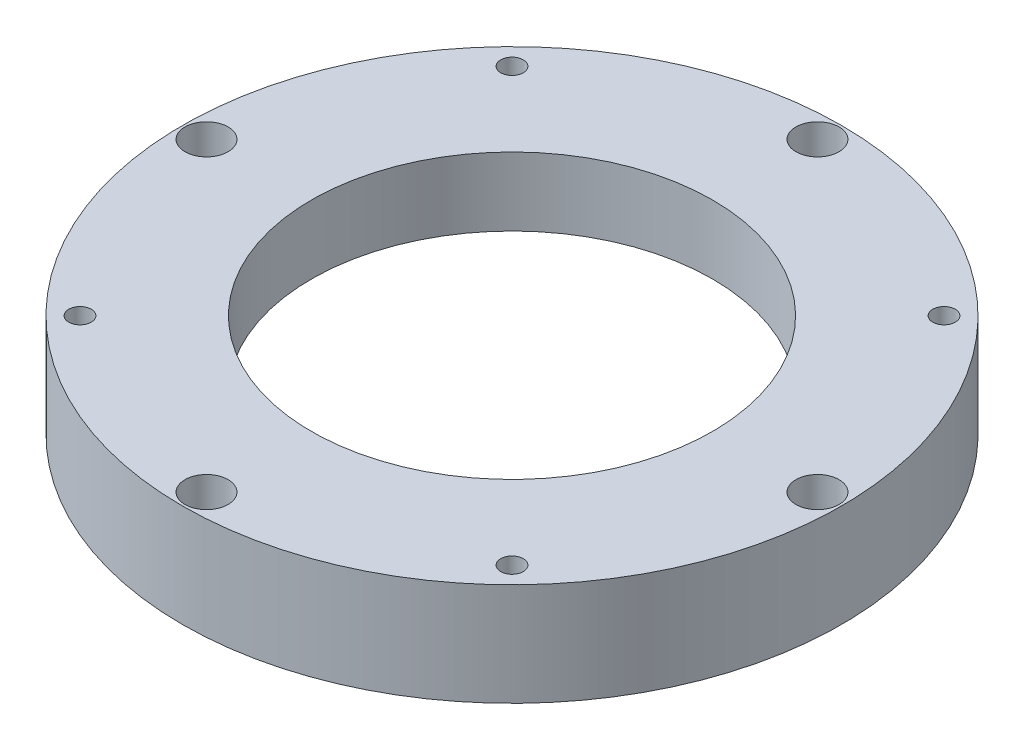
from build123d import *

# Parameters (mm, degrees)
SKETCH1_R           = 45.85
SKETCH1_R_2         = 1.5635
SKETCH1_R_3         = 40
BOSS_EXTRUDE1_DEPTH = 4.7625
BOSS_EXTRUDE2_START = 4.7625
SKETCH1_4_R         = 45.85
SKETCH1_4_R_2       = 1.5635
SKETCH1_4_R_3       = 27.9
BOSS_EXTRUDE2_DEPTH = 4.7625
CUT_EXTRUDE2_DEPTH  = 4.7625
BOSS_EXTRUDE3_START = 4.7625
SKETCH3_R           = 45.85
SKETCH3_R_2         = 3
SKETCH3_R_3         = 27.9
SKETCH3_R_4         = 1.565
BOSS_EXTRUDE3_DEPTH = 4.7625


with BuildPart() as part:
    # Sketch1 → Boss-Extrude1 (new body)
    with BuildSketch(Plane(origin=(0, 0, 0), x_dir=(1, 0, 0), z_dir=(0, 1, 0))):
        Circle(SKETCH1_R)
        with Locations((-30.0520382, -30.0520382)):
            Circle(SKETCH1_R_2, mode=Mode.SUBTRACT)
        with Locations((0, -42.5)):
            Circle(SKETCH1_R_2, mode=Mode.SUBTRACT)
        with Locations((30.0520382, -30.0520382)):
            Circle(SKETCH1_R_2, mode=Mode.SUBTRACT)
        with Locations((-42.5, 0)):
            Circle(SKETCH1_R_2, mode=Mode.SUBTRACT)
        with Locations((-30.0520382, 30.0520382)):
            Circle(SKETCH1_R_2, mode=Mode.SUBTRACT)
        Circle(SKETCH1_R_3, mode=Mode.SUBTRACT)
        with Locations((42.5, 0)):
            Circle(SKETCH1_R_2, mode=Mode.SUBTRACT)
        with Locations((0, 42.5)):
            Circle(SKETCH1_R_2, mode=Mode.SUBTRACT)
        with Locations((30.0520382, 30.0520382)):
            Circle(SKETCH1_R_2, mode=Mode.SUBTRACT)
    extrude(amount=-BOSS_EXTRUDE1_DEPTH)

    # Sketch1<4> → Boss-Extrude2 (add)
    with BuildSketch(Plane(origin=(0, 0, 0), x_dir=(1, 0, 0), z_dir=(0, 1, 0)).offset(BOSS_EXTRUDE2_START)):
        Circle(SKETCH1_4_R)
        with Locations((-30.0520382, -30.0520382)):
            Circle(SKETCH1_4_R_2, mode=Mode.SUBTRACT)
        with Locations((0, -42.5)):
            Circle(SKETCH1_4_R_2, mode=Mode.SUBTRACT)
        with Locations((30.0520382, -30.0520382)):
            Circle(SKETCH1_4_R_2, mode=Mode.SUBTRACT)
        with Locations((-42.5, 0)):
            Circle(SKETCH1_4_R_2, mode=Mode.SUBTRACT)
        with Locations((-30.0520382, 30.0520382)):
            Circle(SKETCH1_4_R_2, mode=Mode.SUBTRACT)
        with Locations((42.5, 0)):
            Circle(SKETCH1_4_R_2, mode=Mode.SUBTRACT)
        with Locations((0, 42.5)):
            Circle(SKETCH1_4_R_2, mode=Mode.SUBTRACT)
        with Locations((30.0520382, 30.0520382)):
            Circle(SKETCH1_4_R_2, mode=Mode.SUBTRACT)
        Circle(SKETCH1_4_R_3, mode=Mode.SUBTRACT)
    extrude(amount=-BOSS_EXTRUDE2_DEPTH)

    # Sketch4 → Cut-Extrude2 (cut)
    with BuildSketch(Plane(origin=(0, 4.7625, 0), x_dir=(1, 0, 0), z_dir=(0, 1, 0))):
        Polygon((28.493192474, -27.3520382), (26.934346747, -30.0520382), (28.493192474, -32.7520382), (31.610883927, -32.7520382), (33.169729654, -30.0520382), (31.610883927, -27.3520382), align=None)
        Polygon((30.0520382, 33.169729654), (27.3520382, 31.610883927), (27.3520382, 28.493192474), (30.0520382, 26.934346747), (32.7520382, 28.493192474), (32.7520382, 31.610883927), align=None)
        Polygon((-27.3520382, -28.493192474), (-30.0520382, -26.934346747), (-32.7520382, -28.493192474), (-32.7520382, -31.610883927), (-30.0520382, -33.169729654), (-27.3520382, -31.610883927), align=None)
        Polygon((-28.493192474, 27.3520382), (-26.934346747, 30.0520382), (-28.493192474, 32.7520382), (-31.610883927, 32.7520382), (-33.169729654, 30.0520382), (-31.610883927, 27.3520382), align=None)
    extrude(amount=-CUT_EXTRUDE2_DEPTH, mode=Mode.SUBTRACT)

    # Sketch3 → Boss-Extrude3 (add)
    with BuildSketch(Plane(origin=(0, 4.7625, 0), x_dir=(1, 0, 0), z_dir=(0, 1, 0)).offset(BOSS_EXTRUDE3_START)):
        Circle(SKETCH3_R)
        with Locations((0, -42.5)):
            Circle(SKETCH3_R_2, mode=Mode.SUBTRACT)
        with Locations((-42.5, 0)):
            Circle(SKETCH3_R_2, mode=Mode.SUBTRACT)
        Circle(SKETCH3_R_3, mode=Mode.SUBTRACT)
        with Locations((42.5, 0)):
            Circle(SKETCH3_R_2, mode=Mode.SUBTRACT)
        with Locations((0, 42.5)):
            Circle(SKETCH3_R_2, mode=Mode.SUBTRACT)
        with Locations((-30.0520382, -30.0520382)):
            Circle(SKETCH3_R_4, mode=Mode.SUBTRACT)
        with Locations((30.0520382, -30.0520382)):
            Circle(SKETCH3_R_4, mode=Mode.SUBTRACT)
        with Locations((-30.0520382, 30.0520382)):
            Circle(SKETCH3_R_4, mode=Mode.SUBTRACT)
        with Locations((30.0520382, 30.0520382)):
            Circle(SKETCH3_R_4, mode=Mode.SUBTRACT)
    extrude(amount=-BOSS_EXTRUDE3_DEPTH)


solid = part.part
